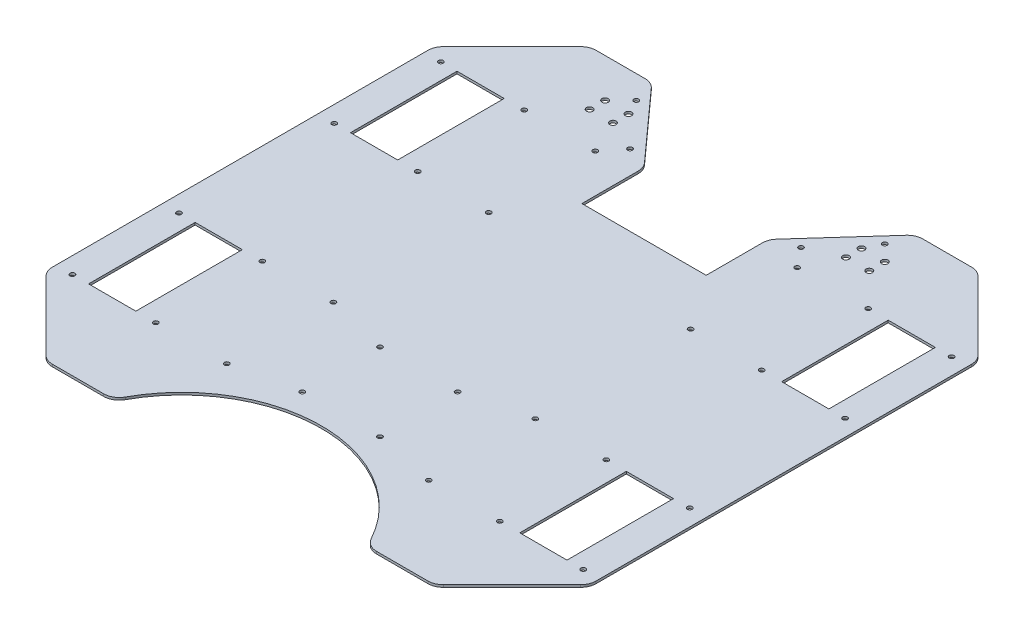
from build123d import *

# Parameters (mm, degrees)
SKETCH_1_R      = 1.55
SKETCH_1_R_2    = 2.05
SKETCH_1_W      = 30.4
SKETCH_1_H      = 68.58
EXTRUDE_1_DEPTH = 1.5
FILLET_1_R      = 10
FILLET_2_R      = 10
FILLET_3_R      = 10


with BuildPart() as part:
    # 草图1 → 凸台-拉伸1 (new body)
    with BuildSketch(Plane(origin=(0, 0, 0), x_dir=(1, 0, 0), z_dir=(0, 1, 0))):
        with BuildLine():
            Line((-125, 175), (-175, 125))
            Line((-175, 125), (-175, -125))
            Line((-175, -125), (-125, -175))
            Line((-125, -175), (-81.710313025, -175))
            ThreePointArc((-81.710313025, -175), (0, -122.728301649), (81.710313025, -175))
            Line((81.710313025, -175), (125, -175))
            Line((125, -175), (175, -125))
            Line((175, -125), (175, 125))
            Line((175, 125), (125, 175))
            Line((125, 175), (85, 175))
            Line((85, 175), (40, 125))
            Line((40, 125), (40, 85))
            Line((40, 85), (-40, 85))
            Line((-40, 85), (-40, 125))
            Line((-40, 125), (-85, 175))
            Line((-85, 175), (-125, 175))
        make_face()
        with Locations((-55, 131)):
            Circle(SKETCH_1_R, mode=Mode.SUBTRACT)
        with Locations((-80, 160)):
            Circle(SKETCH_1_R, mode=Mode.SUBTRACT)
        with Locations((55, 131)):
            Circle(SKETCH_1_R, mode=Mode.SUBTRACT)
        with Locations((80, 160)):
            Circle(SKETCH_1_R, mode=Mode.SUBTRACT)
        with Locations((-65, 118.58)):
            Circle(SKETCH_1_R, mode=Mode.SUBTRACT)
        with Locations((-65, 50)):
            Circle(SKETCH_1_R, mode=Mode.SUBTRACT)
        with Locations((-110.72, 50)):
            Circle(SKETCH_1_R, mode=Mode.SUBTRACT)
        with Locations((-110.72, 118.58)):
            Circle(SKETCH_1_R, mode=Mode.SUBTRACT)
        with Locations((-164.434, 118.58)):
            Circle(SKETCH_1_R, mode=Mode.SUBTRACT)
        with Locations((-164.434, 50)):
            Circle(SKETCH_1_R, mode=Mode.SUBTRACT)
        with Locations((-65, -118.58)):
            Circle(SKETCH_1_R, mode=Mode.SUBTRACT)
        with Locations((-65, -50)):
            Circle(SKETCH_1_R, mode=Mode.SUBTRACT)
        with Locations((-110.72, -50)):
            Circle(SKETCH_1_R, mode=Mode.SUBTRACT)
        with Locations((-110.72, -118.58)):
            Circle(SKETCH_1_R, mode=Mode.SUBTRACT)
        with Locations((-164.434, -50)):
            Circle(SKETCH_1_R, mode=Mode.SUBTRACT)
        with Locations((-164.434, -118.58)):
            Circle(SKETCH_1_R, mode=Mode.SUBTRACT)
        with Locations((65, 50)):
            Circle(SKETCH_1_R, mode=Mode.SUBTRACT)
        with Locations((110.72, 50)):
            Circle(SKETCH_1_R, mode=Mode.SUBTRACT)
        with Locations((110.72, 118.58)):
            Circle(SKETCH_1_R, mode=Mode.SUBTRACT)
        with Locations((65, 118.58)):
            Circle(SKETCH_1_R, mode=Mode.SUBTRACT)
        with Locations((164.434, 118.58)):
            Circle(SKETCH_1_R, mode=Mode.SUBTRACT)
        with Locations((164.434, 50)):
            Circle(SKETCH_1_R, mode=Mode.SUBTRACT)
        with Locations((164.434, -118.58)):
            Circle(SKETCH_1_R, mode=Mode.SUBTRACT)
        with Locations((164.434, -50)):
            Circle(SKETCH_1_R, mode=Mode.SUBTRACT)
        with Locations((110.72, -50)):
            Circle(SKETCH_1_R, mode=Mode.SUBTRACT)
        with Locations((110.72, -118.58)):
            Circle(SKETCH_1_R, mode=Mode.SUBTRACT)
        with Locations((65, -118.58)):
            Circle(SKETCH_1_R, mode=Mode.SUBTRACT)
        with Locations((65, -50)):
            Circle(SKETCH_1_R, mode=Mode.SUBTRACT)
        with Locations((25, -60)):
            Circle(SKETCH_1_R, mode=Mode.SUBTRACT)
        with Locations((25, -110)):
            Circle(SKETCH_1_R, mode=Mode.SUBTRACT)
        with Locations((-25, -60)):
            Circle(SKETCH_1_R, mode=Mode.SUBTRACT)
        with Locations((-25, -110)):
            Circle(SKETCH_1_R, mode=Mode.SUBTRACT)
        with Locations((-75, 150)):
            Circle(SKETCH_1_R_2, mode=Mode.SUBTRACT)
        with Locations((-75, 140)):
            Circle(SKETCH_1_R_2, mode=Mode.SUBTRACT)
        with Locations((-90, 140)):
            Circle(SKETCH_1_R_2, mode=Mode.SUBTRACT)
        with Locations((-90, 150)):
            Circle(SKETCH_1_R_2, mode=Mode.SUBTRACT)
        with Locations((75, 150)):
            Circle(SKETCH_1_R_2, mode=Mode.SUBTRACT)
        with Locations((90, 150)):
            Circle(SKETCH_1_R_2, mode=Mode.SUBTRACT)
        with Locations((90, 140)):
            Circle(SKETCH_1_R_2, mode=Mode.SUBTRACT)
        with Locations((75, 140)):
            Circle(SKETCH_1_R_2, mode=Mode.SUBTRACT)
        with Locations((-138.794, 84.29)):
            Rectangle(SKETCH_1_W, SKETCH_1_H, mode=Mode.SUBTRACT)
        with Locations((138.794, 84.29)):
            Rectangle(SKETCH_1_W, SKETCH_1_H, mode=Mode.SUBTRACT)
        with Locations((-138.794, -84.29)):
            Rectangle(SKETCH_1_W, SKETCH_1_H, mode=Mode.SUBTRACT)
        with Locations((138.794, -84.29)):
            Rectangle(SKETCH_1_W, SKETCH_1_H, mode=Mode.SUBTRACT)
    extrude(amount=EXTRUDE_1_DEPTH)

    # 圆角1
    fillet_1_edges = [part.edges().sort_by_distance(p)[0] for p in [
        (-40, 0.75, -125),
    ]]
    fillet(fillet_1_edges, radius=FILLET_1_R)

    # 圆角2
    fillet_2_edges = [part.edges().sort_by_distance(p)[0] for p in [
        (40, 0.75, -125),
    ]]
    fillet(fillet_2_edges, radius=FILLET_2_R)

    # 圆角3
    fillet_3_edges = [part.edges().sort_by_distance(p)[0] for p in [
        (-85, 0.75, -175),
        (85, 0.75, -175),
        (125, 0.75, -175),
        (175, 0.75, -125),
        (175, 0.75, 125),
        (125, 0.75, 175),
        (81.710313025, 0.75, 175),
        (-81.710313025, 0.75, 175),
        (-125, 0.75, 175),
        (-175, 0.75, 125),
        (-175, 0.75, -125),
        (-125, 0.75, -175),
    ]]
    fillet(fillet_3_edges, radius=FILLET_3_R)


solid = part.part
